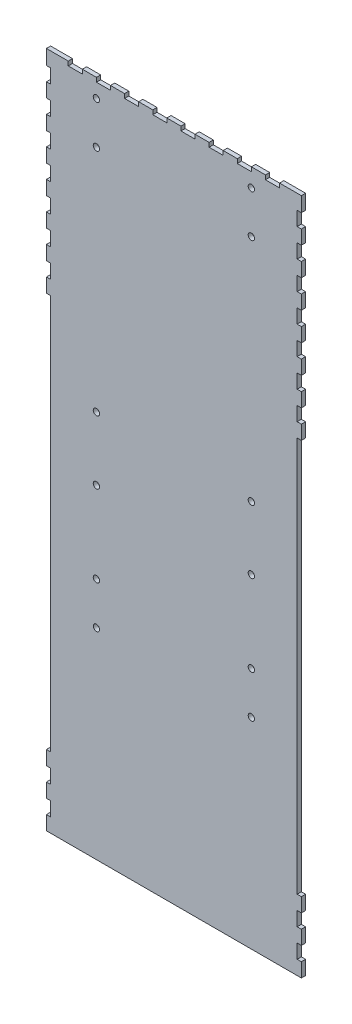
from build123d import *

# Parameters (mm, degrees)
BOSS_EXTRUDE1_DEPTH = 3
SKETCH3_R           = 2.25
CUT_EXTRUDE1_DEPTH  = 10


with BuildPart() as part:
    # Sketch1 → Boss-Extrude1 (new body)
    with BuildSketch(Plane.XY):
        Polygon((3, 408), (-12.5, 408), (-12.5, 405), (-22.5, 405), (-22.5, 408), (-32.5, 408), (-32.5, 405), (-42.5, 405), (-42.5, 408), (-52.5, 408), (-52.5, 405), (-62.5, 405), (-62.5, 408), (-72.5, 408), (-72.5, 405), (-82.5, 405), (-82.5, 408), (-92.5, 408), (-92.5, 405), (-102.5, 405), (-102.5, 408), (-112.5, 408), (-112.5, 405), (-122.5, 405), (-122.5, 408), (-132.5, 408), (-132.5, 405), (-142.5, 405), (-142.5, 408), (-152.5, 408), (-152.5, 405), (-162.5, 405), (-162.5, 408), (-178, 408), (-178, 397.5), (-175, 397.5), (-175, 387.5), (-178, 387.5), (-178, 377.5), (-175, 377.5), (-175, 367.5), (-178, 367.5), (-178, 357.5), (-175, 357.5), (-175, 347.5), (-178, 347.5), (-178, 337.5), (-175, 337.5), (-175, 327.5), (-178, 327.5), (-178, 317.5), (-175, 317.5), (-175, 307.5), (-178, 307.5), (-178, 297.5), (-175, 297.5), (-175, 287.5), (-178, 287.5), (-178, 277.5), (-175, 277.5), (-175, 267.5), (-178, 267.5), (-178, 257.5), (-175, 257.5), (-175, 0), (-175, -23), (-178, -23), (-178, -33), (-175, -33), (-175, -43), (-178, -43), (-178, -53), (-175, -53), (-175, -63), (-178, -63), (-178, -73), (3, -73), (3, -63), (0, -63), (0, -53), (3, -53), (3, -43), (0, -43), (0, -33), (3, -33), (3, -23), (0, -23), (0, 0), (0, 257.5), (3, 257.5), (3, 267.5), (0, 267.5), (0, 277.5), (3, 277.5), (3, 287.5), (0, 287.5), (0, 297.5), (3, 297.5), (3, 307.5), (0, 307.5), (0, 317.5), (3, 317.5), (3, 327.5), (0, 327.5), (0, 337.5), (3, 337.5), (3, 347.5), (0, 347.5), (0, 357.5), (3, 357.5), (3, 367.5), (0, 367.5), (0, 377.5), (3, 377.5), (3, 387.5), (0, 387.5), (0, 397.5), (3, 397.5), align=None)
    extrude(amount=BOSS_EXTRUDE1_DEPTH)

    # Sketch3 → Cut-Extrude1 (cut)
    with BuildSketch(Plane.XY.offset(3)):
        with Locations((-142.5, 365)):
            Circle(SKETCH3_R)
        with Locations((-32.5, 69.549357195)):
            Circle(SKETCH3_R)
        with Locations((-32.5, 99.549357195)):
            Circle(SKETCH3_R)
        with Locations((-142.5, 69.549357195)):
            Circle(SKETCH3_R)
        with Locations((-142.5, 99.549357195)):
            Circle(SKETCH3_R)
        with Locations((-142.5, 157.219761425)):
            Circle(SKETCH3_R)
        with Locations((-32.5, 157.219761425)):
            Circle(SKETCH3_R)
        with Locations((-32.5, 202.219761425)):
            Circle(SKETCH3_R)
        with Locations((-142.5, 202.219761425)):
            Circle(SKETCH3_R)
        with Locations((-32.5, 365)):
            Circle(SKETCH3_R)
        with Locations((-32.5, 395)):
            Circle(SKETCH3_R)
        with Locations((-142.5, 395)):
            Circle(SKETCH3_R)
    extrude(amount=-CUT_EXTRUDE1_DEPTH, mode=Mode.SUBTRACT)


solid = part.part
